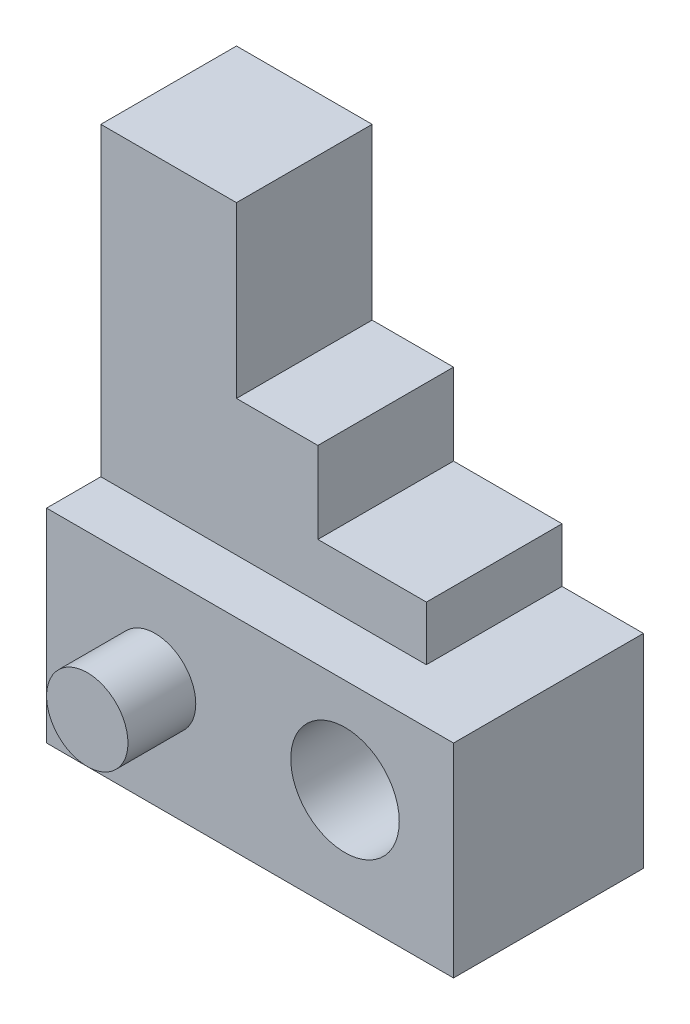
from build123d import *

# Parameters (mm, degrees)
SKETCH1_W           = 60
SKETCH1_H           = 30
SKETCH1_R           = 8
BOSS_EXTRUDE1_DEPTH = 28
BOSS_EXTRUDE2_DEPTH = 20
SKETCH3_R           = 6
BOSS_EXTRUDE3_DEPTH = 10


with BuildPart() as part:
    # Sketch1 → Boss-Extrude1 (new body)
    with BuildSketch(Plane.XY):
        with Locations((30, 15)):
            Rectangle(SKETCH1_W, SKETCH1_H)
        with Locations((44, 16)):
            Circle(SKETCH1_R, mode=Mode.SUBTRACT)
    extrude(amount=BOSS_EXTRUDE1_DEPTH)

    # Sketch2 → Boss-Extrude2 (add)
    with BuildSketch(Plane.XY):
        Polygon((0, 30), (0, 75), (20, 75), (20, 50), (32, 50), (32, 38), (48, 38), (48, 30), align=None)
    extrude(amount=BOSS_EXTRUDE2_DEPTH)

    # Sketch3 → Boss-Extrude3 (add)
    with BuildSketch(Plane.XY.offset(28)):
        with Locations((16, 16)):
            Circle(SKETCH3_R)
    extrude(amount=BOSS_EXTRUDE3_DEPTH)


solid = part.part
